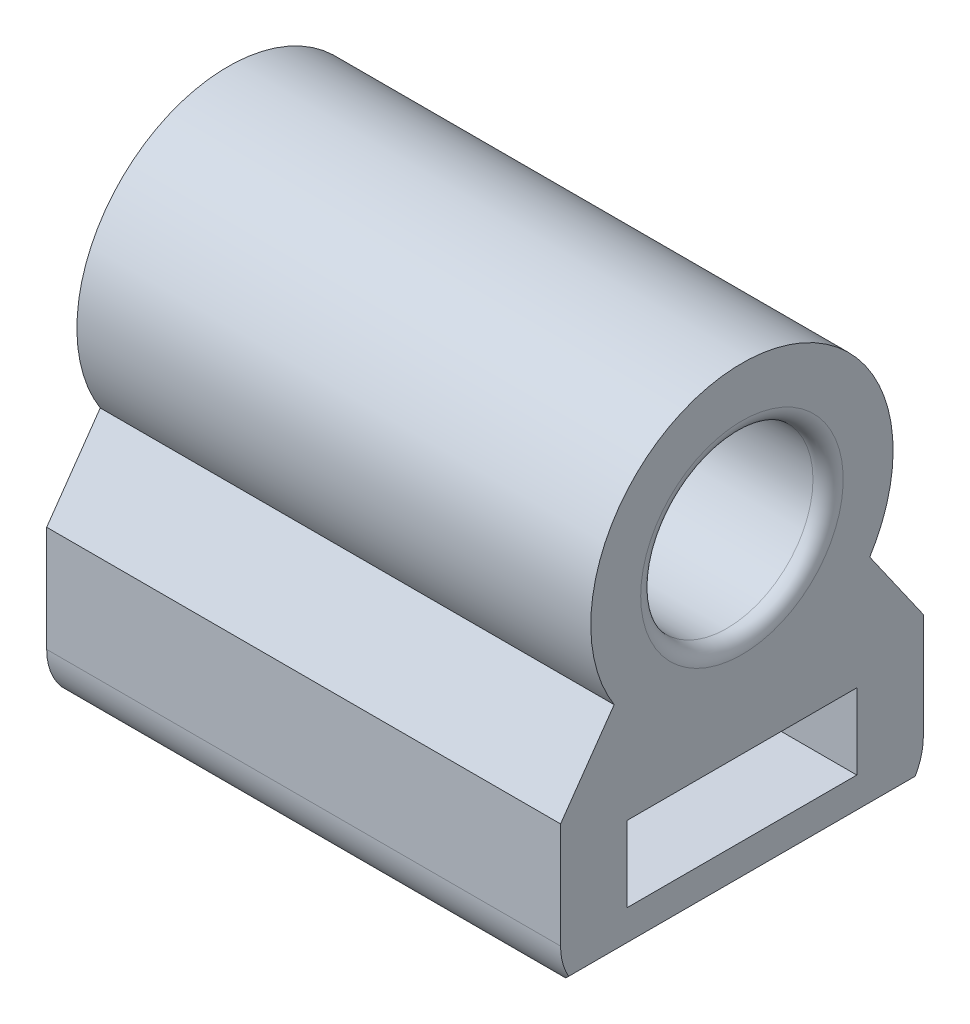
from build123d import *

# Parameters (mm, degrees)
SKETCH_1_W      = 12
SKETCH_1_H      = 12
SKETCH_1_R      = 1
SKETCH_1_W_2    = 5
EXTRUDE_1_DEPTH = 2
SKETCH_2_W      = 17
SKETCH_2_H      = 2.2
EXTRUDE_2_DEPTH = 2.5
EXTRUDE_3_DEPTH = 17
CHAMFER_1_SIZE  = 1
FILLET_4_R      = 2


with BuildPart() as part:
    # 草图1 → 凸台-拉伸1 (new body)
    # profile 1 of 2: a face of its own
    with BuildSketch(Plane(origin=(0, 0, 0), x_dir=(1, 0, 0), z_dir=(0, 1, 0))):
        Rectangle(SKETCH_1_W, SKETCH_1_H)
        with Locations(Location((2.5, 0, 0), (0, 0, 270))):
            Circle(SKETCH_1_R, mode=Mode.SUBTRACT)
        with Locations(Location((-2.5, 0, 0), (0, 0, 270))):
            Circle(SKETCH_1_R, mode=Mode.SUBTRACT)
    # profile 2 of 2: a face of its own
    with BuildSketch(Plane(origin=(0, 0, 0), x_dir=(1, 0, 0), z_dir=(0, 1, 0))):
        with Locations((-8.5, 0)):
            Rectangle(SKETCH_1_W_2, SKETCH_1_H)
    extrude(amount=EXTRUDE_1_DEPTH)

    # 草图2 → 凸台-拉伸2 (add)
    with BuildSketch(Plane(origin=(0, 2, 0), x_dir=(1, 0, 0), z_dir=(0, 1, 0))):
        with Locations((-2.5, 4.9)):
            Rectangle(SKETCH_2_W, SKETCH_2_H)
        with Locations((-2.5, -4.9)):
            Rectangle(SKETCH_2_W, SKETCH_2_H)
    extrude(amount=EXTRUDE_2_DEPTH)

    # 草图4 → 凸台-拉伸3 (add)
    with BuildSketch(Plane(origin=(6, 0, 0), x_dir=(0, 0, -1), z_dir=(1, 0, 0))):
        with BuildLine():
            Line((-6, 5.5), (-6, 4.5))
            Line((-6, 4.5), (6, 4.5))
            Line((6, 4.5), (6, 5.5))
            Line((6, 5.5), (4.227921486, 8.030790397))
            ThreePointArc((4.227921486, 8.030790397), (0, 15.7), (-4.227921486, 8.030790397))
            Line((-4.227921486, 8.030790397), (-6, 5.5))
        make_face()
        with BuildLine():
            ThreePointArc((0, 7.85), (-2.85, 10.7), (0, 13.55))
            ThreePointArc((0, 13.55), (2.85, 10.7), (0, 7.85))
        make_face(mode=Mode.SUBTRACT)
    extrude(amount=-EXTRUDE_3_DEPTH)

    # 圆角1: read off the stored shape, not the designer's step
    # 圆角1 outline → 圆角1 (revolve, cut)
    with BuildSketch(Plane(origin=(0, 10.7, 0), x_dir=(0, 1, 0), z_dir=(0, 0, -1))):
        with BuildLine():
            Line((2.85, 6), (2.85, 5.5))
            ThreePointArc((2.85, 5.5), (2.996446609, 5.853553391), (3.35, 6))
            Line((3.35, 6), (2.85, 6))
        make_face()
        with BuildLine():
            ThreePointArc((3.35, -11), (2.996446609, -10.853553391), (2.85, -10.5))
            Line((2.85, -10.5), (2.85, -11))
            Line((2.85, -11), (3.35, -11))
        make_face()
    revolve(axis=Axis((0, 10.7, 0), (1, 0, 0)), mode=Mode.SUBTRACT)

    # 倒角1
    chamfer_1_edges = [part.edges().sort_by_distance(p)[0] for p in [
        (6, 0, 0),
    ]]
    chamfer(chamfer_1_edges, length=CHAMFER_1_SIZE)

    # 圆角4
    fillet_4_edges = [part.edges().sort_by_distance(p)[0] for p in [
        (-3, 0, -6),
        (-3, 0, 6),
    ]]
    fillet(fillet_4_edges, radius=FILLET_4_R)


solid = part.part
